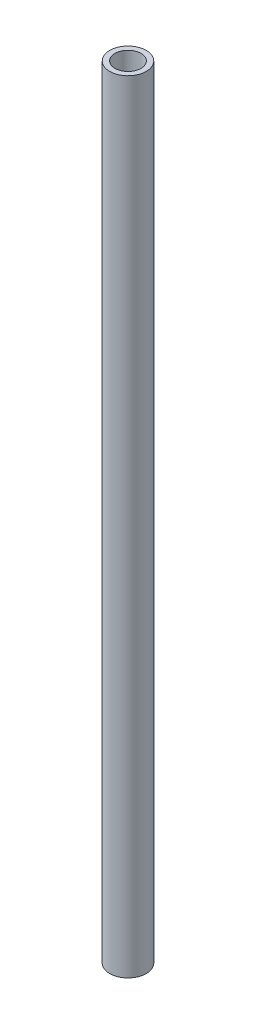
from build123d import *

# Parameters (mm, degrees)
SKETCH1_R           = 3.5
SKETCH1_R_2         = 2.5
BOSS_EXTRUDE1_DEPTH = 150


with BuildPart() as part:
    # Sketch1 → Boss-Extrude1 (new body)
    with BuildSketch(Plane(origin=(0, 0, 0), x_dir=(1, 0, 0), z_dir=(0, 1, 0))):
        Circle(SKETCH1_R)
        Circle(SKETCH1_R_2, mode=Mode.SUBTRACT)
    extrude(amount=BOSS_EXTRUDE1_DEPTH)


solid = part.part
